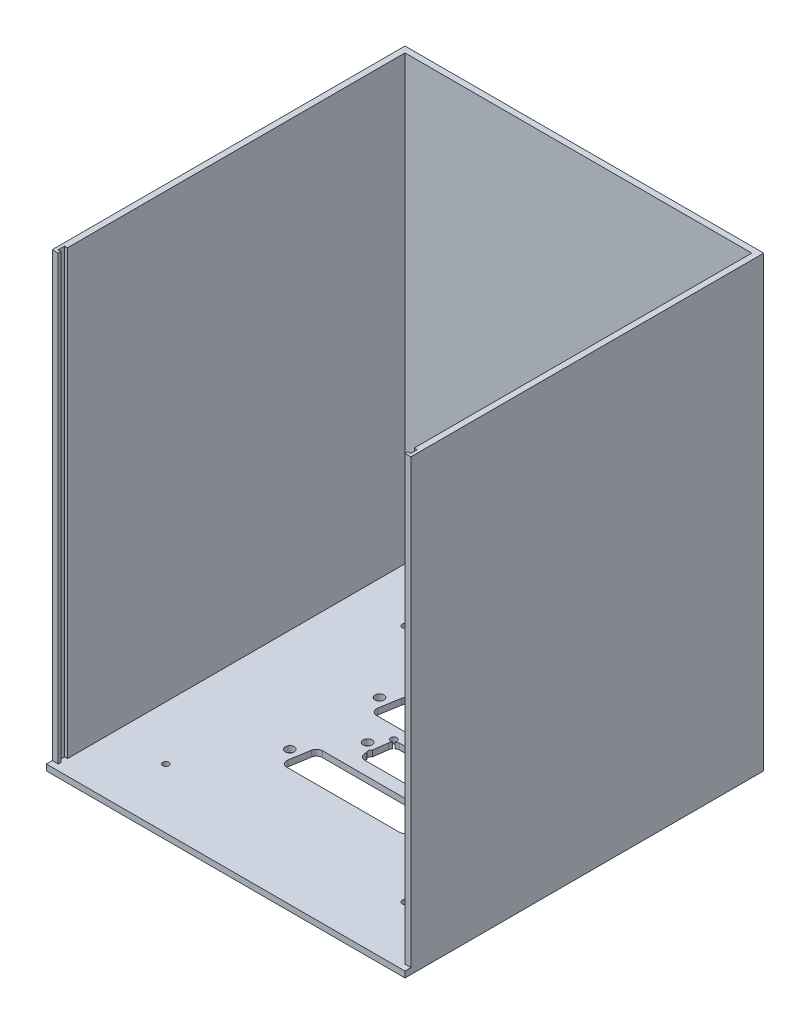
from build123d import *

# Parameters (mm, degrees)
SKETCH1_W             = 120
SKETCH1_H             = 120
MAIN_BODY_DEPTH       = 150
SKETCH11_W            = 116
SKETCH11_H            = 118
HOLLOW_DEPTH          = 148
SKETCH12_W            = 2
SKETCH12_H            = 2
LID_CUT_DEPTH         = 148
SKETCH13_W            = 1
SKETCH13_H            = 2.2
RAIL_CUT_DEPTH        = 148
MAIN_PCB_HOLES_REACH  = 174.337
SKETCH2_R             = 1
LED_PCB_HOLES_REACH   = 174.337
SKETCH3_R             = 1.05
CONNECTOR_SLOTS_REACH = 174.337
SKETCH4_R             = 1.5


with BuildPart() as part:
    # Sketch1 → Main-Body (new body)
    with BuildSketch(Plane(origin=(0, 0, 0), x_dir=(1, 0, 0), z_dir=(0, 1, 0))):
        Rectangle(SKETCH1_W, SKETCH1_H)
    extrude(amount=MAIN_BODY_DEPTH)

    # Sketch11 → Hollow (cut)
    with BuildSketch(Plane(origin=(0, 150, 0), x_dir=(1, 0, 0), z_dir=(0, 1, 0))):
        with Locations((0, -1)):
            Rectangle(SKETCH11_W, SKETCH11_H)
    extrude(amount=-HOLLOW_DEPTH, mode=Mode.SUBTRACT)

    # Sketch12 → Lid-Cut (cut)
    with BuildSketch(Plane(origin=(0, 150, 0), x_dir=(1, 0, 0), z_dir=(0, 1, 0))):
        with Locations((-59, -59)):
            Rectangle(SKETCH12_W, SKETCH12_H)
    lid_cut = extrude(amount=-LID_CUT_DEPTH, mode=Mode.SUBTRACT)

    # Mirror-Lid-Cut: Lid-Cut across plane
    add(lid_cut.mirror(Plane(origin=(0, 0, 0), x_dir=(0, 0, 1), z_dir=(1, 0, 0))), mode=Mode.SUBTRACT)

    # Sketch13 → Rail-Cut (cut)
    with BuildSketch(Plane(origin=(0, 150, 0), x_dir=(1, 0, 0), z_dir=(0, 1, 0))):
        with Locations((-58.5, -56)):
            Rectangle(SKETCH13_W, SKETCH13_H)
    rail_cut = extrude(amount=-RAIL_CUT_DEPTH, mode=Mode.SUBTRACT)

    # Sketch2 → Main-PCB-Holes (cut, up to next)
    with BuildSketch(Plane.XZ, mode=Mode.PRIVATE) as main_pcb_holes_sk1:
        with Locations((-40, 40)):
            Circle(SKETCH2_R)
    main_pcb_holes_tool1 = extrude(main_pcb_holes_sk1.sketch, amount=-MAIN_PCB_HOLES_REACH, mode=Mode.PRIVATE) & part.part
    # Sketch2 → Main-PCB-Holes (cut, up to next)
    with BuildSketch(Plane.XZ, mode=Mode.PRIVATE) as main_pcb_holes_sk2:
        with Locations((40, 40)):
            Circle(SKETCH2_R)
    main_pcb_holes_tool2 = extrude(main_pcb_holes_sk2.sketch, amount=-MAIN_PCB_HOLES_REACH, mode=Mode.PRIVATE) & part.part
    # Sketch2 → Main-PCB-Holes (cut, up to next)
    with BuildSketch(Plane.XZ, mode=Mode.PRIVATE) as main_pcb_holes_sk3:
        with Locations((40, -40)):
            Circle(SKETCH2_R)
    main_pcb_holes_tool3 = extrude(main_pcb_holes_sk3.sketch, amount=-MAIN_PCB_HOLES_REACH, mode=Mode.PRIVATE) & part.part
    # Sketch2 → Main-PCB-Holes (cut, up to next)
    with BuildSketch(Plane.XZ, mode=Mode.PRIVATE) as main_pcb_holes_sk4:
        with Locations((-40, -40)):
            Circle(SKETCH2_R)
    main_pcb_holes_tool4 = extrude(main_pcb_holes_sk4.sketch, amount=-MAIN_PCB_HOLES_REACH, mode=Mode.PRIVATE) & part.part
    add(main_pcb_holes_tool1.solids().sort_by_distance((-40, 0, 40))[0], mode=Mode.SUBTRACT)
    add(main_pcb_holes_tool2.solids().sort_by_distance((40, 0, 40))[0], mode=Mode.SUBTRACT)
    add(main_pcb_holes_tool3.solids().sort_by_distance((40, 0, -40))[0], mode=Mode.SUBTRACT)
    add(main_pcb_holes_tool4.solids().sort_by_distance((-40, 0, -40))[0], mode=Mode.SUBTRACT)

    # Sketch3 → LED-PCB-Holes (cut, up to next)
    with BuildSketch(Plane(origin=(0, 150, 0), x_dir=(1, 0, 0), z_dir=(0, 1, 0)), mode=Mode.PRIVATE) as led_pcb_holes_sk1:
        with Locations((-9, 5.23)):
            Circle(SKETCH3_R)
    led_pcb_holes_tool1 = extrude(led_pcb_holes_sk1.sketch, amount=-LED_PCB_HOLES_REACH, mode=Mode.PRIVATE) & part.part
    # Sketch3 → LED-PCB-Holes (cut, up to next)
    with BuildSketch(Plane(origin=(0, 150, 0), x_dir=(1, 0, 0), z_dir=(0, 1, 0)), mode=Mode.PRIVATE) as led_pcb_holes_sk2:
        with Locations((9, 5.23)):
            Circle(SKETCH3_R)
    led_pcb_holes_tool2 = extrude(led_pcb_holes_sk2.sketch, amount=-LED_PCB_HOLES_REACH, mode=Mode.PRIVATE) & part.part
    # Sketch3 → LED-PCB-Holes (cut, up to next)
    with BuildSketch(Plane(origin=(0, 150, 0), x_dir=(1, 0, 0), z_dir=(0, 1, 0)), mode=Mode.PRIVATE) as led_pcb_holes_sk3:
        with Locations((9, -2.27)):
            Circle(SKETCH3_R)
    led_pcb_holes_tool3 = extrude(led_pcb_holes_sk3.sketch, amount=-LED_PCB_HOLES_REACH, mode=Mode.PRIVATE) & part.part
    # Sketch3 → LED-PCB-Holes (cut, up to next)
    with BuildSketch(Plane(origin=(0, 150, 0), x_dir=(1, 0, 0), z_dir=(0, 1, 0)), mode=Mode.PRIVATE) as led_pcb_holes_sk4:
        with Locations((-9, -2.27)):
            Circle(SKETCH3_R)
    led_pcb_holes_tool4 = extrude(led_pcb_holes_sk4.sketch, amount=-LED_PCB_HOLES_REACH, mode=Mode.PRIVATE) & part.part
    add(led_pcb_holes_tool1.solids().sort_by_distance((-9, 150, -5.23))[0], mode=Mode.SUBTRACT)
    add(led_pcb_holes_tool2.solids().sort_by_distance((9, 150, -5.23))[0], mode=Mode.SUBTRACT)
    add(led_pcb_holes_tool3.solids().sort_by_distance((9, 150, 2.27))[0], mode=Mode.SUBTRACT)
    add(led_pcb_holes_tool4.solids().sort_by_distance((-9, 150, 2.27))[0], mode=Mode.SUBTRACT)

    # Sketch4 → Connector-Slots (cut, up to next)
    with BuildSketch(Plane.XZ, mode=Mode.PRIVATE) as connector_slots_sk1:
        with Locations((-12.5, 0)):
            Circle(SKETCH4_R)
    connector_slots_tool1 = extrude(connector_slots_sk1.sketch, amount=-CONNECTOR_SLOTS_REACH, mode=Mode.PRIVATE) & part.part
    # Sketch4 → Connector-Slots (cut, up to next)
    with BuildSketch(Plane.XZ, mode=Mode.PRIVATE) as connector_slots_sk2:
        with Locations((12.5, 0)):
            Circle(SKETCH4_R)
    connector_slots_tool2 = extrude(connector_slots_sk2.sketch, amount=-CONNECTOR_SLOTS_REACH, mode=Mode.PRIVATE) & part.part
    # Sketch4 → Connector-Slots (cut, up to next)
    with BuildSketch(Plane.XZ, mode=Mode.PRIVATE) as connector_slots_sk3:
        with Locations((-23.52, -15)):
            Circle(SKETCH4_R)
    connector_slots_tool3 = extrude(connector_slots_sk3.sketch, amount=-CONNECTOR_SLOTS_REACH, mode=Mode.PRIVATE) & part.part
    # Sketch4 → Connector-Slots (cut, up to next)
    with BuildSketch(Plane.XZ, mode=Mode.PRIVATE) as connector_slots_sk4:
        with Locations((23.52, -15)):
            Circle(SKETCH4_R)
    connector_slots_tool4 = extrude(connector_slots_sk4.sketch, amount=-CONNECTOR_SLOTS_REACH, mode=Mode.PRIVATE) & part.part
    # Sketch4 → Connector-Slots (cut, up to next)
    with BuildSketch(Plane.XZ, mode=Mode.PRIVATE) as connector_slots_sk5:
        with Locations((-23.52, 15)):
            Circle(SKETCH4_R)
    connector_slots_tool5 = extrude(connector_slots_sk5.sketch, amount=-CONNECTOR_SLOTS_REACH, mode=Mode.PRIVATE) & part.part
    # Sketch4 → Connector-Slots (cut, up to next)
    with BuildSketch(Plane.XZ, mode=Mode.PRIVATE) as connector_slots_sk6:
        with Locations((23.52, 15)):
            Circle(SKETCH4_R)
    connector_slots_tool6 = extrude(connector_slots_sk6.sketch, amount=-CONNECTOR_SLOTS_REACH, mode=Mode.PRIVATE) & part.part
    # Sketch4 → Connector-Slots (cut, up to next)
    with BuildSketch(Plane.XZ, mode=Mode.PRIVATE) as connector_slots_sk7:
        with BuildLine():
            Line((-6.891594987, -5.117891943), (6.891594987, -5.117891943))
            ThreePointArc((6.891594987, -5.117891943), (8.211781315, -4.620259427), (8.875, -3.375))
            Line((8.875, -3.375), (9.75, 3.375))
            ThreePointArc((9.75, 3.375), (9.268962471, 4.952294386), (7.766594987, 5.632108057))
            Line((7.766594987, 5.632108057), (-7.766594987, 5.632108057))
            ThreePointArc((-7.766594987, 5.632108057), (-9.268962471, 4.952294386), (-9.75, 3.375))
            Line((-9.75, 3.375), (-8.875, -3.375))
            ThreePointArc((-8.875, -3.375), (-8.211781315, -4.620259427), (-6.891594987, -5.117891943))
        make_face()
    connector_slots_tool7 = extrude(connector_slots_sk7.sketch, amount=-CONNECTOR_SLOTS_REACH, mode=Mode.PRIVATE) & part.part
    # Sketch4 → Connector-Slots (cut, up to next)
    with BuildSketch(Plane.XZ, mode=Mode.PRIVATE) as connector_slots_sk8:
        with BuildLine():
            Line((-17.652212152, -20.046202025), (17.652212152, -20.046202025))
            ThreePointArc((17.652212152, -20.046202025), (18.944961945, -19.57224199), (19.625, -18.375))
            Line((19.625, -18.375), (20.75, -11.625))
            ThreePointArc((20.75, -11.625), (20.303252117, -10.003452233), (18.777212152, -9.296202025))
            Line((18.777212152, -9.296202025), (-18.777212152, -9.296202025))
            ThreePointArc((-18.777212152, -9.296202025), (-20.303252117, -10.003452233), (-20.75, -11.625))
            Line((-20.75, -11.625), (-19.625, -18.375))
            ThreePointArc((-19.625, -18.375), (-18.944961945, -19.57224199), (-17.652212152, -20.046202025))
        make_face()
    connector_slots_tool8 = extrude(connector_slots_sk8.sketch, amount=-CONNECTOR_SLOTS_REACH, mode=Mode.PRIVATE) & part.part
    # Sketch4 → Connector-Slots (cut, up to next)
    with BuildSketch(Plane.XZ, mode=Mode.PRIVATE) as connector_slots_sk9:
        with BuildLine():
            Line((-17.652212152, 9.953797975), (17.652212152, 9.953797975))
            ThreePointArc((17.652212152, 9.953797975), (18.944961945, 10.42775801), (19.625, 11.625))
            Line((19.625, 11.625), (20.75, 18.375))
            ThreePointArc((20.75, 18.375), (20.303252117, 19.996547767), (18.777212152, 20.703797975))
            Line((18.777212152, 20.703797975), (-18.777212152, 20.703797975))
            ThreePointArc((-18.777212152, 20.703797975), (-20.303252117, 19.996547767), (-20.75, 18.375))
            Line((-20.75, 18.375), (-19.625, 11.625))
            ThreePointArc((-19.625, 11.625), (-18.944961945, 10.42775801), (-17.652212152, 9.953797975))
        make_face()
    connector_slots_tool9 = extrude(connector_slots_sk9.sketch, amount=-CONNECTOR_SLOTS_REACH, mode=Mode.PRIVATE) & part.part
    add(connector_slots_tool1.solids().sort_by_distance((-12.5, 0, 0))[0], mode=Mode.SUBTRACT)
    add(connector_slots_tool2.solids().sort_by_distance((12.5, 0, 0))[0], mode=Mode.SUBTRACT)
    add(connector_slots_tool3.solids().sort_by_distance((-23.52, 0, -15))[0], mode=Mode.SUBTRACT)
    add(connector_slots_tool4.solids().sort_by_distance((23.52, 0, -15))[0], mode=Mode.SUBTRACT)
    add(connector_slots_tool5.solids().sort_by_distance((-23.52, 0, 15))[0], mode=Mode.SUBTRACT)
    add(connector_slots_tool6.solids().sort_by_distance((23.52, 0, 15))[0], mode=Mode.SUBTRACT)
    add(connector_slots_tool7.solids().sort_by_distance((0, 0, 0.368259))[0], mode=Mode.SUBTRACT)
    add(connector_slots_tool8.solids().sort_by_distance((0, 0, -14.605881))[0], mode=Mode.SUBTRACT)
    add(connector_slots_tool9.solids().sort_by_distance((0, 0, 15.394119))[0], mode=Mode.SUBTRACT)

    # Mirror-Rail-Cut: Rail-Cut across plane
    add(rail_cut.mirror(Plane(origin=(0, 0, 0), x_dir=(0, 0, 1), z_dir=(1, 0, 0))), mode=Mode.SUBTRACT)


solid = part.part
